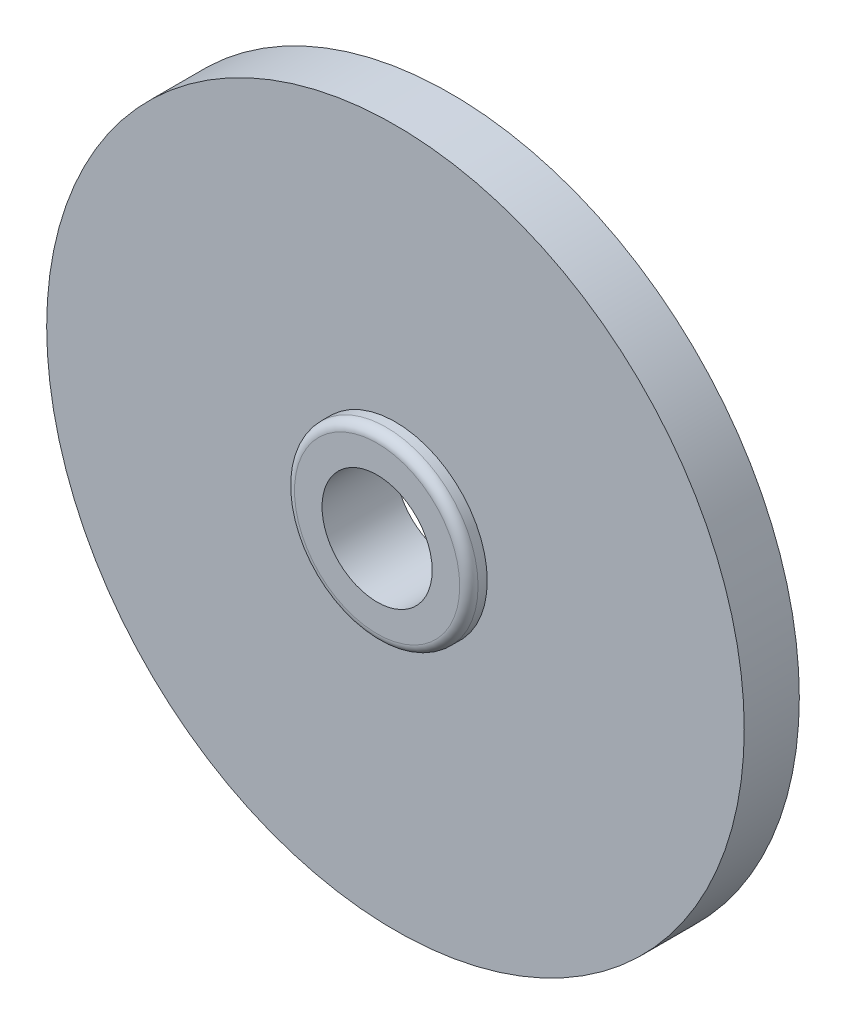
from build123d import *

# Parameters (mm, degrees)
SKETCH2_R          = 19
EXTRUDE1_DEPTH     = 3
SKETCH3_R          = 5
EXTRUDE3_DEPTH     = 1
EXTRUDE4_START     = -4
EXTRUDE4_OUTLINE_R = 3
EXTRUDE4_DEPTH     = 4
FILLET1_R          = 0.5
SCALE1_SCALE       = 0.5


# Read off the part's stored shape, not the designer's step: Extrude4
with BuildPart() as part:
    # Sketch2 → Extrude1 (new body)
    with BuildSketch(Plane.XY):
        Circle(SKETCH2_R)
    extrude(amount=EXTRUDE1_DEPTH)

    # Sketch3 → Extrude3 (add)
    with BuildSketch(Plane.XY.offset(3)):
        Circle(SKETCH3_R)
    extrude(amount=EXTRUDE3_DEPTH)

    # Extrude4 outline → Extrude4 (cut)
    with BuildSketch(Plane.XY.offset(4).offset(EXTRUDE4_START)):
        Circle(EXTRUDE4_OUTLINE_R)
    extrude(amount=EXTRUDE4_DEPTH, mode=Mode.SUBTRACT)

    # Fillet1
    fillet1_edges = [part.edges().sort_by_distance(p)[0] for p in [
        (-5, 0, 4),
    ]]
    fillet(fillet1_edges, radius=FILLET1_R)


with BuildPart() as part_1:
    # Scale1: scaled about (0, 0, 0)
    add(part.part.scale(SCALE1_SCALE))


solid = part_1.part
